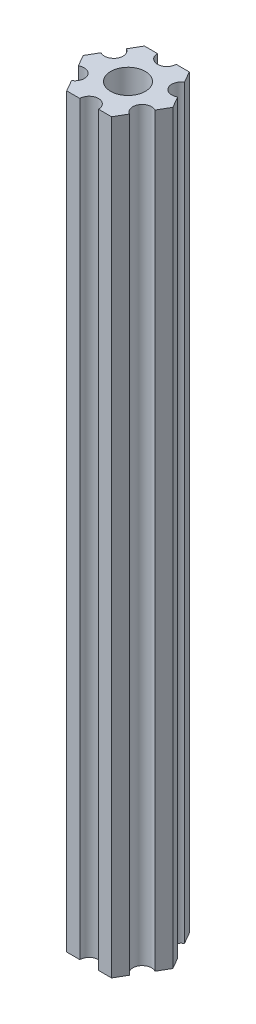
from build123d import *

# Parameters (mm, degrees)
ESBO_O1_R                = 2.79
RESSALTO_EXTRUS_O1_DEPTH = 120


with BuildPart() as part:
    # Esboço1 → Ressalto-extrusão1 (new body)
    with BuildSketch(Plane(origin=(0, 85, 0), x_dir=(1, 0, 0), z_dir=(0, 1, 0))):
        with BuildLine():
            Line((6.162658774, -1.825961894), (7.216878365, 0))
            Line((7.216878365, 0), (6.162658774, 1.825961894))
            ThreePointArc((6.162658774, 1.825961894), (4.113620668, 2.375), (4.662658774, 4.424038106))
            Line((4.662658774, 4.424038106), (3.608439182, 6.25))
            Line((3.608439182, 6.25), (1.5, 6.25))
            ThreePointArc((1.5, 6.25), (0, 4.75), (-1.5, 6.25))
            Line((-1.5, 6.25), (-3.608439182, 6.25))
            Line((-3.608439182, 6.25), (-4.662658774, 4.424038106))
            ThreePointArc((-4.662658774, 4.424038106), (-4.113620668, 2.375), (-6.162658774, 1.825961894))
            Line((-6.162658774, 1.825961894), (-7.216878365, 0))
            Line((-7.216878365, 0), (-6.162658774, -1.825961894))
            ThreePointArc((-6.162658774, -1.825961894), (-4.113620668, -2.375), (-4.662658774, -4.424038106))
            Line((-4.662658774, -4.424038106), (-3.608439182, -6.25))
            Line((-3.608439182, -6.25), (-1.5, -6.25))
            ThreePointArc((-1.5, -6.25), (0, -4.75), (1.5, -6.25))
            Line((1.5, -6.25), (3.608439182, -6.25))
            Line((3.608439182, -6.25), (4.662658774, -4.424038106))
            ThreePointArc((4.662658774, -4.424038106), (4.113620668, -2.375), (6.162658774, -1.825961894))
        make_face()
        Circle(ESBO_O1_R, mode=Mode.SUBTRACT)
    extrude(amount=-RESSALTO_EXTRUS_O1_DEPTH)


solid = part.part
